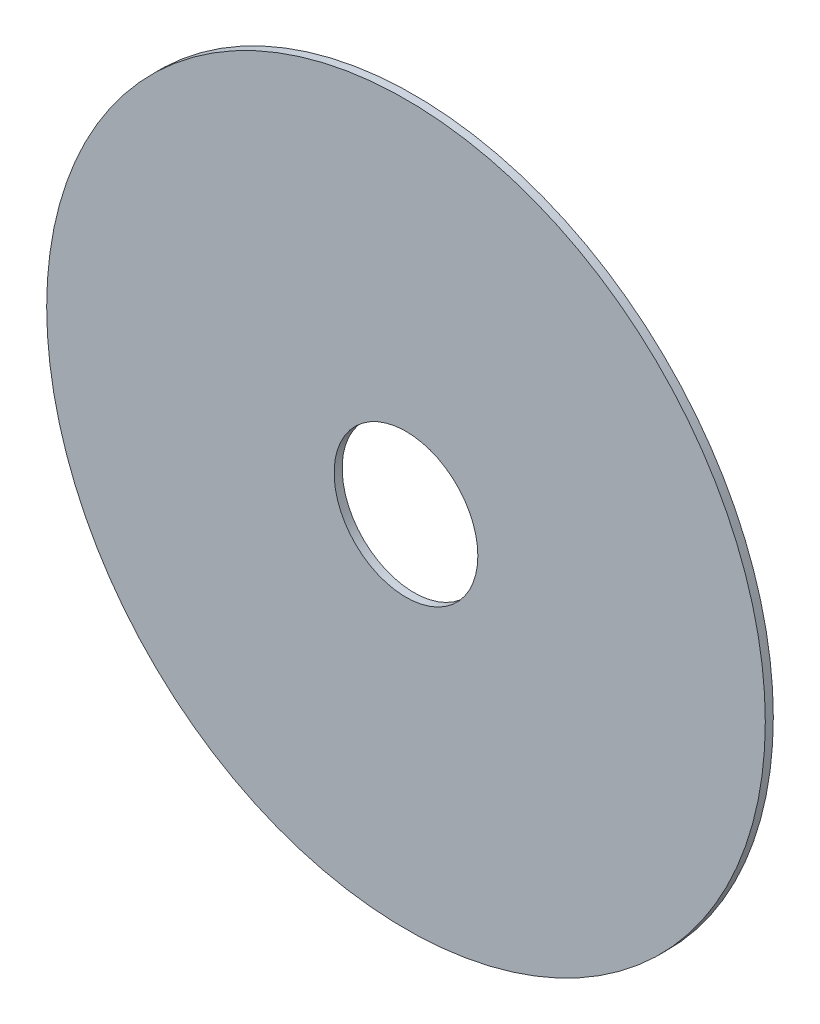
from build123d import *

# Parameters (mm, degrees)
SKETCH1_R      = 56
SKETCH1_R_2    = 11.2
EXTRUDE1_DEPTH = 1.25


with BuildPart() as part:
    # Sketch1 → Extrude1 (new body)
    with BuildSketch(Plane.XY):
        Circle(SKETCH1_R)
        Circle(SKETCH1_R_2, mode=Mode.SUBTRACT)
    extrude(amount=EXTRUDE1_DEPTH)


solid = part.part
